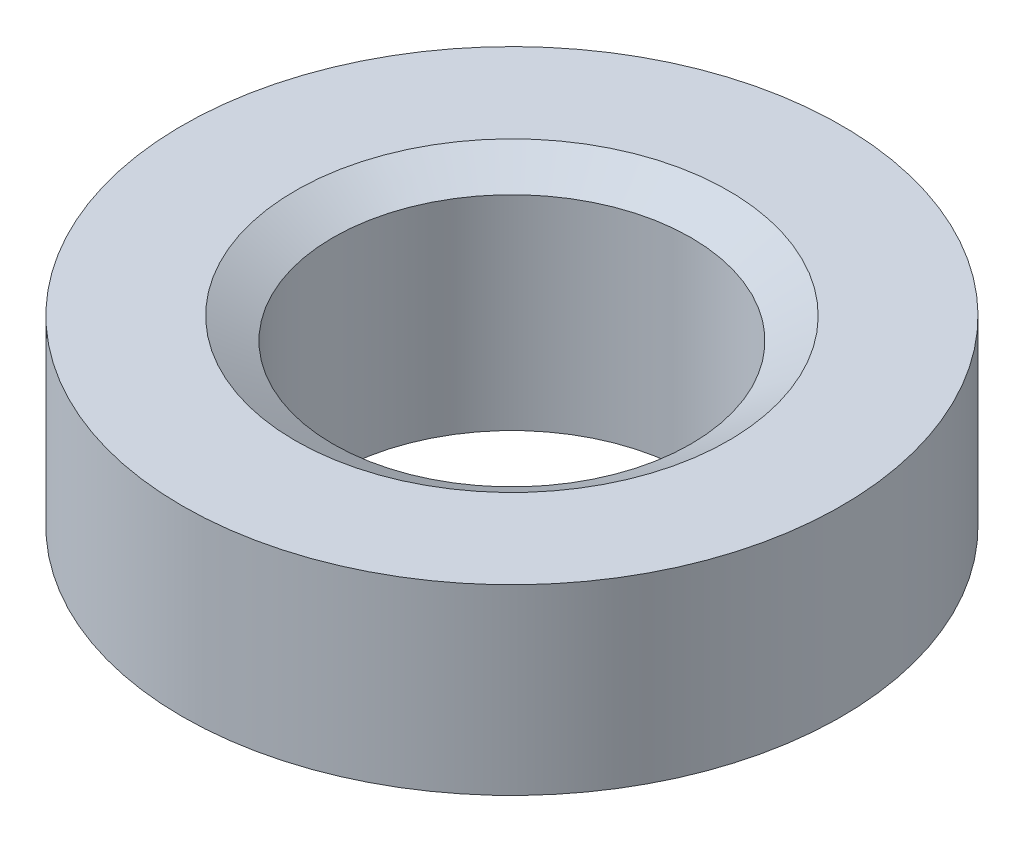
from build123d import *

# Parameters (mm, degrees)
SKETCH1_R           = 4.375
SKETCH1_R_2         = 2.375
BOSS_EXTRUDE1_DEPTH = 3
CHAMFER1_SIZE       = 0.5
CHAMFER1_SIZE2      = 0.288675135
CHAMFER2_SIZE       = 1
CHAMFER2_SIZE2      = 0.577350269


with BuildPart() as part:
    # Sketch1 → Boss-Extrude1 (new body)
    with BuildSketch(Plane(origin=(0, 0, 0), x_dir=(1, 0, 0), z_dir=(0, 1, 0))):
        Circle(SKETCH1_R)
        Circle(SKETCH1_R_2, mode=Mode.SUBTRACT)
    extrude(amount=BOSS_EXTRUDE1_DEPTH)

    # Chamfer1
    chamfer1_edges = [part.edges().sort_by_distance(p)[0] for p in [
        (-2.375, 3, 0),
    ]]
    chamfer1_side = [part.faces().sort_by_distance(p)[0] for p in [
        (-4.251256313, 3, 0),
    ]]
    chamfer(chamfer1_edges, length=CHAMFER1_SIZE, length2=CHAMFER1_SIZE2, reference=chamfer1_side[0])

    # Chamfer2
    chamfer2_edges = [part.edges().sort_by_distance(p)[0] for p in [
        (-4.375, 0, 0),
    ]]
    chamfer2_side = [part.faces().sort_by_distance(p)[0] for p in [
        (-4.251256313, 0, 0),
    ]]
    chamfer(chamfer2_edges, length=CHAMFER2_SIZE, length2=CHAMFER2_SIZE2, reference=chamfer2_side[0])


solid = part.part
